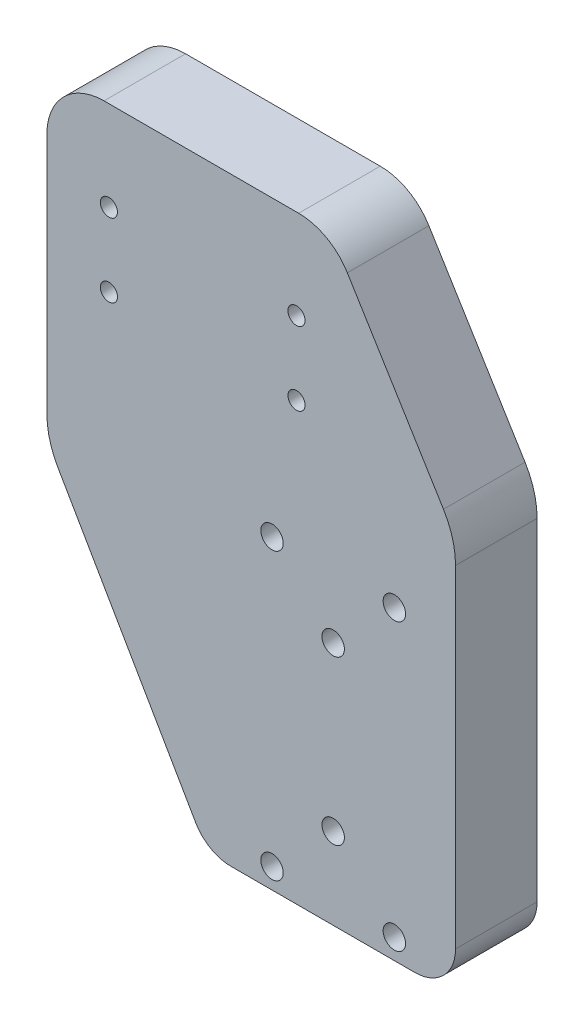
from build123d import *

# Parameters (mm, degrees)
BOSS_EXTRUDE1_DEPTH     = 20
FILLET1_R               = 10
TAP_DRILL_FOR_M5_TAP1_D = 4.2
M5_CLEARANCE_HOLE1_D    = 5.5
FILLET2_R               = 4
BOSS_EXTRUDE2_DEPTH     = 20


with BuildPart() as part:
    # Sketch1 → Boss-Extrude1 (new body)
    with BuildSketch(Plane.XY):
        with BuildLine():
            Line((-170.200000001, 540.824594888), (-129.309401077, 470))
            Line((-129.309401077, 470), (-93, 470))
            ThreePointArc((-93, 470), (-90.878679656, 470.878679656), (-90, 473))
            Line((-90, 473), (-90, 564.25527297))
            Line((-90, 564.25527297), (-116.225329238, 607))
            Line((-116.225329238, 607), (-170.200000001, 607))
            Line((-170.200000001, 607), (-170.200000001, 540.824594888))
        make_face()
    extrude(amount=BOSS_EXTRUDE1_DEPTH)

    # Fillet1
    fillet1_edges = [part.edges().sort_by_distance(p)[0] for p in [
        (-129.309401077, 470, 10),
        (-170.200000001, 540.824594888, 10),
        (-90, 564.25527297, 10),
    ]]
    fillet(fillet1_edges, radius=FILLET1_R)

    # Tap Drill for M5 Tap1 (through all)
    with Locations(Plane(origin=(0, 0, 0), x_dir=(-1, 0, 0), z_dir=(0, 0, -1))):
        with Locations((119.000000001, 595), (119.000000001, 577), (165.000000001, 577), (165.000000001, 595)):
            Hole(TAP_DRILL_FOR_M5_TAP1_D / 2)

    # M5 Clearance Hole1 (through all)
    with Locations(Plane.XY.offset(20)):
        with Locations((-95, 545), (-125, 545), (-125, 475), (-95, 475), (-110, 490), (-110, 530)):
            Hole(M5_CLEARANCE_HOLE1_D / 2)

    # Fillet2
    fillet2_edges = [part.edges().sort_by_distance(p)[0] for p in [
        (-116.225329238, 607, 10),
        (-170.200000001, 607, 10),
    ]]
    fillet(fillet2_edges, radius=FILLET2_R)

    # Sketch11 → Boss-Extrude2 (add)
    with BuildSketch(Plane.XY.offset(20)):
        with BuildLine():
            ThreePointArc((-143.743157806, 475), (-140.082903769, 471.339745962), (-135.082903769, 470))
            Line((-135.082903769, 470), (-123.535898385, 470))
            ThreePointArc((-123.535898385, 470), (-128.535898385, 471.339745962), (-132.196152423, 475))
            Line((-132.196152423, 475), (-168.860254039, 538.504086813))
            ThreePointArc((-168.860254039, 538.504086813), (-169.859258264, 540.915896362), (-170.200000001, 543.504086813))
            Line((-170.200000001, 543.504086813), (-170.200000001, 603))
            ThreePointArc((-170.200000001, 603), (-169.028427125, 605.828427125), (-166.200000001, 607))
            Line((-166.200000001, 607), (-118.464037729, 607))
            ThreePointArc((-118.464037729, 607), (-116.510482263, 606.490504411), (-115.054590744, 605.091810521))
            Line((-115.054590744, 605.091810521), (-91.476382537, 566.661632408))
            ThreePointArc((-91.476382537, 566.661632408), (-90.37617086, 564.149073659), (-90, 561.432106106))
            Line((-90, 561.432106106), (-90, 473))
            ThreePointArc((-90, 473), (-90.878679656, 470.878679656), (-93, 470))
            Line((-93, 470), (-90, 470))
            ThreePointArc((-90, 470), (-82.928932188, 472.928932188), (-80, 480))
            Line((-80, 480), (-80, 561.432106106))
            ThreePointArc((-80, 561.432106106), (-80.75234172, 566.866041212), (-82.952765074, 571.89115871))
            Line((-82.952765074, 571.89115871), (-106.530973281, 610.321336823))
            ThreePointArc((-106.530973281, 610.321336823), (-111.626593598, 615.216765438), (-118.464037729, 617))
            Line((-118.464037729, 617), (-166.200000001, 617))
            ThreePointArc((-166.200000001, 617), (-176.099494937, 612.899494937), (-180.200000001, 603))
            Line((-180.200000001, 603), (-180.200000001, 543.504086813))
            ThreePointArc((-180.200000001, 543.504086813), (-179.518516526, 538.327705911), (-177.520508076, 533.504086813))
            Line((-177.520508076, 533.504086813), (-143.743157806, 475))
        make_face()
    extrude(amount=-BOSS_EXTRUDE2_DEPTH)


solid = part.part
